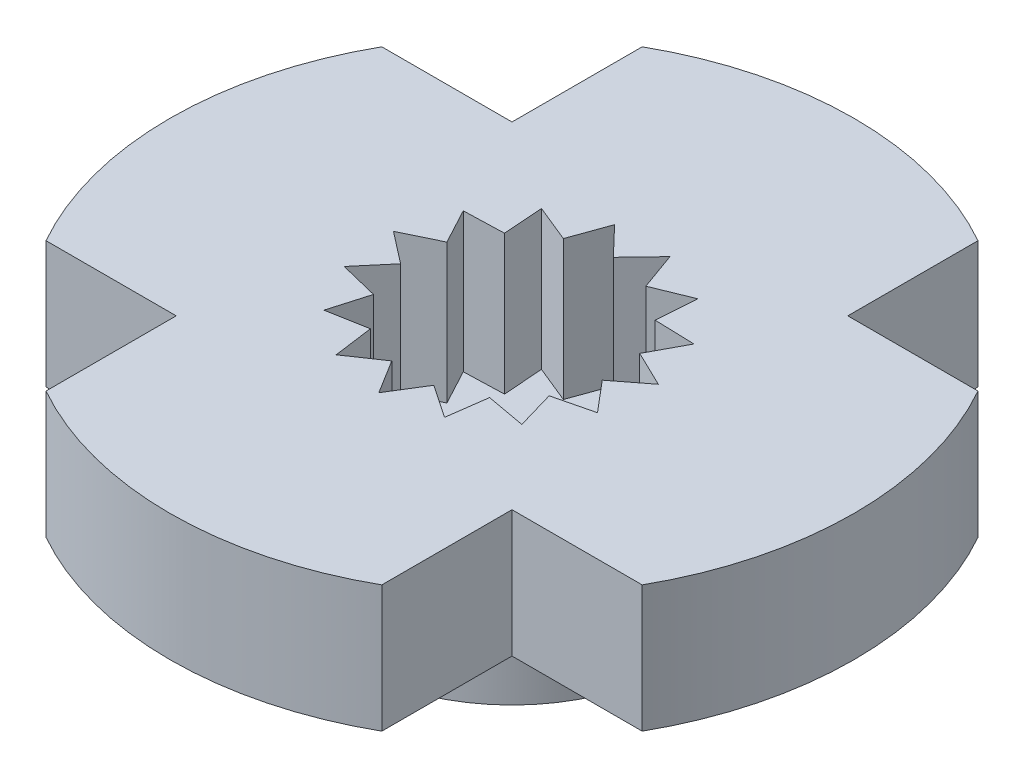
from build123d import *

# Parameters (mm, degrees)
EXTRUDE_1_DEPTH     = 2
SKETCH_2_R          = 2.575
SKETCH_2_R_2        = 0.85
EXTRUDE_2_DEPTH     = 1.5
CUT_EXTRUDE_2_DEPTH = 2.2


with BuildPart() as part:
    # ｽｹｯﾁ1 → ﾎﾞｽ - 押し出し1 (new body)
    with BuildSketch(Plane(origin=(0, 0, 0), x_dir=(1, 0, 0), z_dir=(0, 1, 0))):
        with BuildLine():
            Line((2.65, 4.705050478), (2.65, 2.65))
            Line((2.65, 2.65), (4.705050478, 2.65))
            ThreePointArc((4.705050478, 2.65), (5.4, 0), (4.705050478, -2.65))
            Line((4.705050478, -2.65), (2.65, -2.65))
            Line((2.65, -2.65), (2.65, -4.705050478))
            ThreePointArc((2.65, -4.705050478), (0, -5.4), (-2.65, -4.705050478))
            Line((-2.65, -4.705050478), (-2.65, -2.65))
            Line((-2.65, -2.65), (-4.705050478, -2.65))
            ThreePointArc((-4.705050478, -2.65), (-5.4, 0), (-4.705050478, 2.65))
            Line((-4.705050478, 2.65), (-2.65, 2.65))
            Line((-2.65, 2.65), (-2.65, 4.705050478))
            ThreePointArc((-2.65, 4.705050478), (0, 5.4), (2.65, 4.705050478))
        make_face()
    extrude(amount=EXTRUDE_1_DEPTH)

    # ｽｹｯﾁ2 → ﾎﾞｽ - 押し出し2 (add)
    with BuildSketch(Plane.XZ):
        Circle(SKETCH_2_R)
        Circle(SKETCH_2_R_2, mode=Mode.SUBTRACT)
    extrude(amount=EXTRUDE_2_DEPTH)

    # ｽｹｯﾁ4 → ｶｯﾄ - 押し出し2 (cut)
    with BuildSketch(Plane(origin=(0, 2, 0), x_dir=(1, 0, 0), z_dir=(0, 1, 0))):
        Polygon((0, 1.6), (0.437016815, 2.056002469), (0.650778629, 1.461672732), (1.235486269, 1.700500964), (1.189031721, 1.07060897), (1.820328922, 1.050967393), (1.521690426, 0.494427191), (2.090420168, 0.219712013), (1.591235033, -0.167245541), (1.999058776, -0.64953357), (1.385640646, -0.8), (1.56204196, -1.406468898), (0.940456404, -1.294427191), (0.854933899, -1.920212977), (0.332658705, -1.565036161), (0, -2.101934787), (-0.332658705, -1.565036161), (-0.854933899, -1.920212977), (-0.940456404, -1.294427191), (-1.56204196, -1.406468898), (-1.385640646, -0.8), (-1.999058776, -0.64953357), (-1.591235033, -0.167245541), (-2.090420168, 0.219712013), (-1.521690426, 0.494427191), (-1.820328922, 1.050967393), (-1.189031721, 1.07060897), (-1.235486269, 1.700500964), (-0.650778629, 1.461672732), (-0.437016815, 2.056002469), align=None)
    extrude(amount=-CUT_EXTRUDE_2_DEPTH, mode=Mode.SUBTRACT)


solid = part.part
